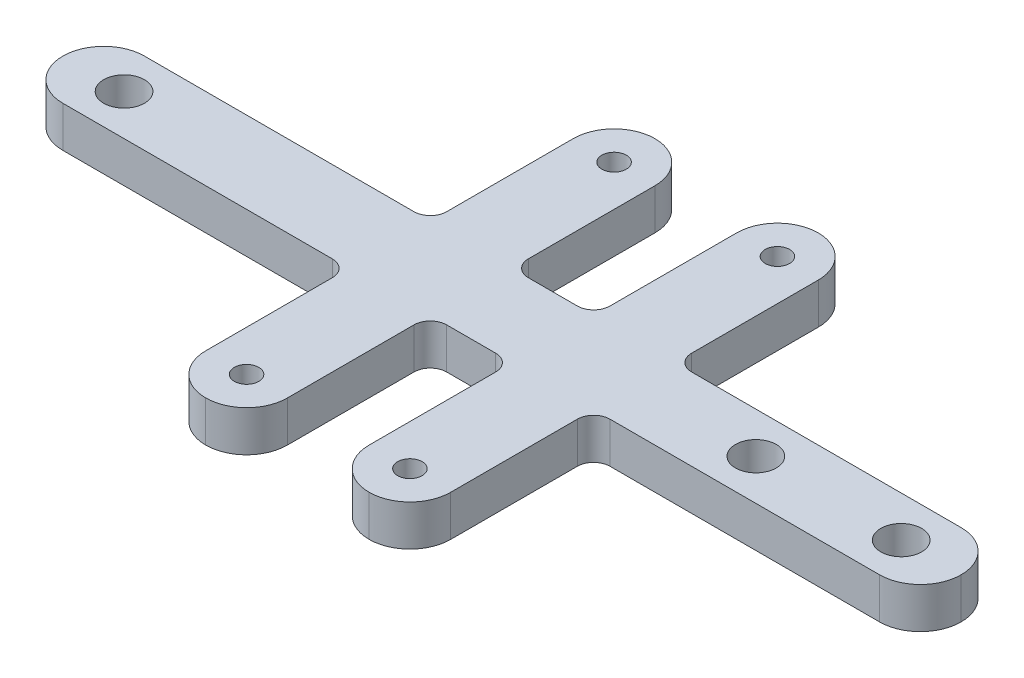
from build123d import *

# Parameters (mm, degrees)
SKETCH1_W                 = 139.7
SKETCH1_H                 = 12.7
BOSS_EXTRUDE1_DEPTH       = 6.35
SKETCH2_R                 = 3.175
CUT_EXTRUDE2_DEPTH        = 4.7625
SKETCH3_R                 = 3.175
CUT_EXTRUDE3_DEPTH        = 4.7625
FILLET1_R                 = 6.35
F_6_CLEARANCE_HOLE1_D     = 3.7973
F_6_CLEARANCE_HOLE1_DEPTH = 25.4
F_6_CLEARANCE_HOLE1_TIP   = 1.140824014
F_6_CLEARANCE_HOLE2_D     = 3.7973
F_6_CLEARANCE_HOLE2_DEPTH = 25.4
F_6_CLEARANCE_HOLE2_TIP   = 1.140824014
SKETCH8_W                 = 12.7
SKETCH8_H                 = 69.85
BOSS_EXTRUDE2_DEPTH       = 6.35
F_6_CLEARANCE_HOLE3_D     = 3.7973
F_6_CLEARANCE_HOLE3_DEPTH = 25.4
F_6_CLEARANCE_HOLE3_TIP   = 1.140824014
FILLET2_R                 = 2.54
FILLET3_R                 = 6.35


with BuildPart() as part:
    # Sketch1 → Boss-Extrude1 (new body)
    with BuildSketch(Plane(origin=(0, 0, 0), x_dir=(1, 0, 0), z_dir=(0, 1, 0))):
        Rectangle(SKETCH1_W, SKETCH1_H)
    extrude(amount=BOSS_EXTRUDE1_DEPTH)

    # Sketch2 → Cut-Extrude2 (cut)
    with BuildSketch(Plane(origin=(0, 6.35, 0), x_dir=(1, 0, 0), z_dir=(0, 1, 0))):
        with Locations(Location((-60.325, 0, 0), (0, 0, 270))):
            Circle(SKETCH2_R)
        with Locations(Location((37.9222, 0, 0), (0, 0, 270))):
            Circle(SKETCH2_R)
        with Locations(Location((60.52312, 0, 0), (0, 0, 270))):
            Circle(SKETCH2_R)
    extrude(amount=-CUT_EXTRUDE2_DEPTH, mode=Mode.SUBTRACT)

    # Sketch3 → Cut-Extrude3 (cut)
    with BuildSketch(Plane.XZ):
        with Locations(Location((-12.7, 0, 0), (0, 0, 270))):
            Circle(SKETCH3_R)
        with Locations(Location((12.7, 0, 0), (0, 0, 270))):
            Circle(SKETCH3_R)
    extrude(amount=-CUT_EXTRUDE3_DEPTH, mode=Mode.SUBTRACT)

    # Fillet1
    fillet1_edges = [part.edges().sort_by_distance(p)[0] for p in [
        (69.85, 3.175, 6.35),
        (69.85, 3.175, -6.35),
        (-69.85, 3.175, 6.35),
        (-69.85, 3.175, -6.35),
    ]]
    fillet(fillet1_edges, radius=FILLET1_R - 0.0001)  # a hair under: the kernel refuses the full size

    # #6 Clearance Hole1
    with Locations(Plane(origin=(0, 1.5875, 0), x_dir=(-1, 0, 0), z_dir=(0, 1, 0))):
        with Locations((-60.52312, 0), (-37.9222, 0), (60.325, 0)):
            Hole(F_6_CLEARANCE_HOLE1_D / 2, depth=F_6_CLEARANCE_HOLE1_DEPTH)
            with Locations((0, 0, -(F_6_CLEARANCE_HOLE1_DEPTH + F_6_CLEARANCE_HOLE1_TIP / 2))):  # 118° drill point
                Cone(0, F_6_CLEARANCE_HOLE1_D / 2, F_6_CLEARANCE_HOLE1_TIP, mode=Mode.SUBTRACT)

    # #6 Clearance Hole2
    with Locations(Plane.XZ.offset(-4.7625)):
        with Locations((-12.7, 0), (12.7, 0)):
            Hole(F_6_CLEARANCE_HOLE2_D / 2, depth=F_6_CLEARANCE_HOLE2_DEPTH)
            with Locations((0, 0, -(F_6_CLEARANCE_HOLE2_DEPTH + F_6_CLEARANCE_HOLE2_TIP / 2))):  # 118° drill point
                Cone(0, F_6_CLEARANCE_HOLE2_D / 2, F_6_CLEARANCE_HOLE2_TIP, mode=Mode.SUBTRACT)

    # Sketch8 → Boss-Extrude2 (add)
    with BuildSketch(Plane(origin=(0, 6.35, 0), x_dir=(1, 0, 0), z_dir=(0, 1, 0))):
        with Locations((-12.7, 0)):
            Rectangle(SKETCH8_W, SKETCH8_H)
        with Locations((12.7, 0)):
            Rectangle(SKETCH8_W, SKETCH8_H)
    extrude(amount=-BOSS_EXTRUDE2_DEPTH)

    # #6 Clearance Hole3
    with Locations(Plane(origin=(0, 6.35, 0), x_dir=(-1, 0, 0), z_dir=(0, 1, 0))):
        with Locations((12.7, -28.575), (12.7, 28.575), (-12.7, 28.575), (-12.7, -28.575)):
            Hole(F_6_CLEARANCE_HOLE3_D / 2, depth=F_6_CLEARANCE_HOLE3_DEPTH)
            with Locations((0, 0, -(F_6_CLEARANCE_HOLE3_DEPTH + F_6_CLEARANCE_HOLE3_TIP / 2))):  # 118° drill point
                Cone(0, F_6_CLEARANCE_HOLE3_D / 2, F_6_CLEARANCE_HOLE3_TIP, mode=Mode.SUBTRACT)

    # Fillet2
    fillet2_edges = [part.edges().sort_by_distance(p)[0] for p in [
        (6.35, 3.175, 6.35),
        (6.35, 3.175, -6.35),
        (19.05, 3.175, 6.35),
        (19.05, 3.175, -6.35),
        (-19.05, 3.175, 6.35),
        (-19.05, 3.175, -6.35),
        (-6.35, 3.175, 6.35),
        (-6.35, 3.175, -6.35),
    ]]
    fillet(fillet2_edges, radius=FILLET2_R)

    # Fillet3
    fillet3_edges = [part.edges().sort_by_distance(p)[0] for p in [
        (19.05, 3.175, -34.925),
        (6.35, 3.175, -34.925),
        (-6.35, 3.175, -34.925),
        (-19.05, 3.175, -34.925),
        (-19.05, 3.175, 34.925),
        (-6.35, 3.175, 34.925),
        (6.35, 3.175, 34.925),
        (19.05, 3.175, 34.925),
    ]]
    fillet(fillet3_edges, radius=FILLET3_R - 0.0001)  # a hair under: the kernel refuses the full size


solid = part.part
